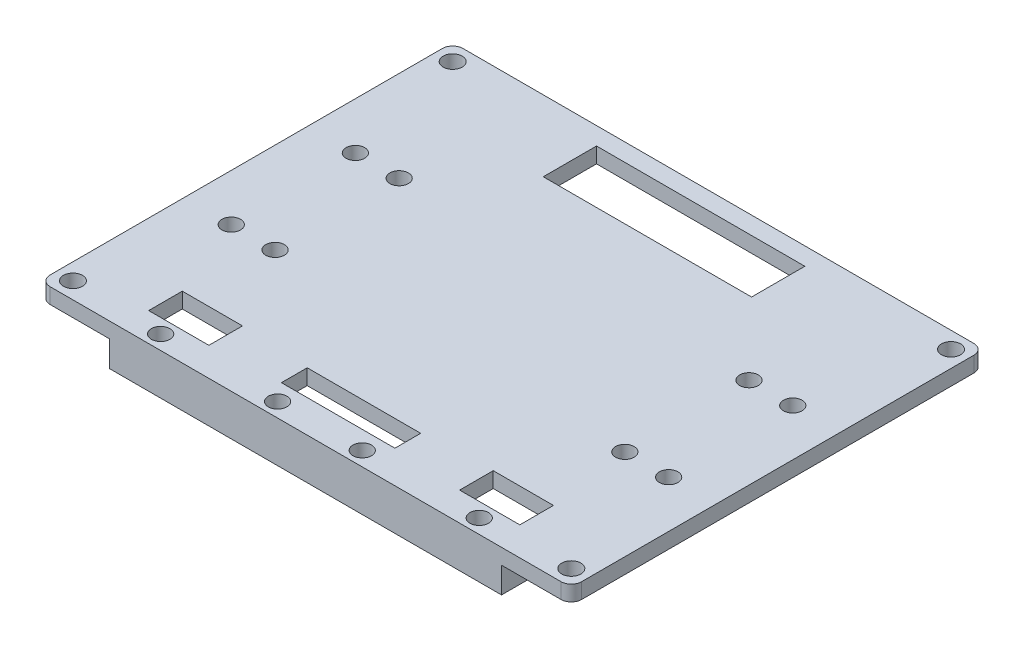
from build123d import *

# Parameters (mm, degrees)
SKETCH_1_R          = 1.85
SKETCH_1_W          = 11.667697598
SKETCH_1_H          = 6.517356375
SKETCH_1_R_2        = 1.8
SKETCH_1_W_2        = 22
SKETCH_1_H_2        = 5
SKETCH_1_W_3        = 40.374860346
SKETCH_1_H_3        = 10.321291022
EXTRUDE_1_DEPTH     = 3
SKETCH_2_W          = 75.93825213
SKETCH_2_H          = 5.545458332
EXTRUDE_2_DEPTH     = 8
SKETCH_3_R          = 1.8
CUT_EXTRUDE_1_DEPTH = 15


with BuildPart() as part:
    # 草图1 → 凸台-拉伸1 (new body)
    with BuildSketch(Plane(origin=(0, 0, 0), x_dir=(1, 0, 0), z_dir=(0, 1, 0))):
        with BuildLine():
            Line((-49.5, -40), (49.5, -40))
            ThreePointArc((49.5, -40), (50.914213562, -39.414213562), (51.5, -38))
            Line((51.5, -38), (51.5, 38))
            ThreePointArc((51.5, 38), (50.914213562, 39.414213562), (49.5, 40))
            Line((49.5, 40), (-49.5, 40))
            ThreePointArc((-49.5, 40), (-50.914213562, 39.414213562), (-51.5, 38))
            Line((-51.5, 38), (-51.5, -38))
            ThreePointArc((-51.5, -38), (-50.914213562, -39.414213562), (-49.5, -40))
        make_face()
        with Locations((-48.296806281, -36.796806281)):
            Circle(SKETCH_1_R, mode=Mode.SUBTRACT)
        with Locations((-30.135277266, -31.195863481)):
            Rectangle(SKETCH_1_W, SKETCH_1_H, mode=Mode.SUBTRACT)
        with Locations((-42.391806281, -12.03)):
            Circle(SKETCH_1_R_2, mode=Mode.SUBTRACT)
        with Locations((-33.901806281, -12.03)):
            Circle(SKETCH_1_R_2, mode=Mode.SUBTRACT)
        with Locations((0, -31.19586348)):
            Rectangle(SKETCH_1_W_2, SKETCH_1_H_2, mode=Mode.SUBTRACT)
        with Locations((30.135277266, -31.195863481)):
            Rectangle(SKETCH_1_W, SKETCH_1_H, mode=Mode.SUBTRACT)
        with Locations((48.296806281, -36.796806281)):
            Circle(SKETCH_1_R, mode=Mode.SUBTRACT)
        with Locations((33.901806281, -12.03)):
            Circle(SKETCH_1_R_2, mode=Mode.SUBTRACT)
        with Locations((42.391806281, -12.03)):
            Circle(SKETCH_1_R_2, mode=Mode.SUBTRACT)
        with Locations((-42.391806281, 12.03)):
            Circle(SKETCH_1_R_2, mode=Mode.SUBTRACT)
        with Locations((-33.901806281, 12.03)):
            Circle(SKETCH_1_R_2, mode=Mode.SUBTRACT)
        with Locations((-48.296806281, 36.796806281)):
            Circle(SKETCH_1_R, mode=Mode.SUBTRACT)
        with Locations((33.901806281, 12.03)):
            Circle(SKETCH_1_R_2, mode=Mode.SUBTRACT)
        with Locations((42.391806281, 12.03)):
            Circle(SKETCH_1_R_2, mode=Mode.SUBTRACT)
        with Locations((0, 31.409786363)):
            Rectangle(SKETCH_1_W_3, SKETCH_1_H_3, mode=Mode.SUBTRACT)
        with Locations((48.296806281, 36.796806281)):
            Circle(SKETCH_1_R, mode=Mode.SUBTRACT)
    extrude(amount=EXTRUDE_1_DEPTH)

    # 草图2 → 凸台-拉伸2 (add)
    with BuildSketch(Plane(origin=(0, 3, 0), x_dir=(1, 0, 0), z_dir=(0, 1, 0))):
        with Locations((0, -37.227270834)):
            Rectangle(SKETCH_2_W, SKETCH_2_H)
    extrude(amount=-EXTRUDE_2_DEPTH)

    # 草图3 → 切除-拉伸1 (cut)
    with BuildSketch(Plane(origin=(0, -5, 0), x_dir=(-1, 0, 0), z_dir=(0, -1, 0))):
        with Locations((-8.2, -37.227270834)):
            Circle(SKETCH_3_R)
        with Locations((8.2, -37.227270834)):
            Circle(SKETCH_3_R)
        with Locations((-30.875113943, -37.227270834)):
            Circle(SKETCH_3_R)
        with Locations((30.875113943, -37.227270834)):
            Circle(SKETCH_3_R)
    extrude(amount=-CUT_EXTRUDE_1_DEPTH, mode=Mode.SUBTRACT)


solid = part.part
